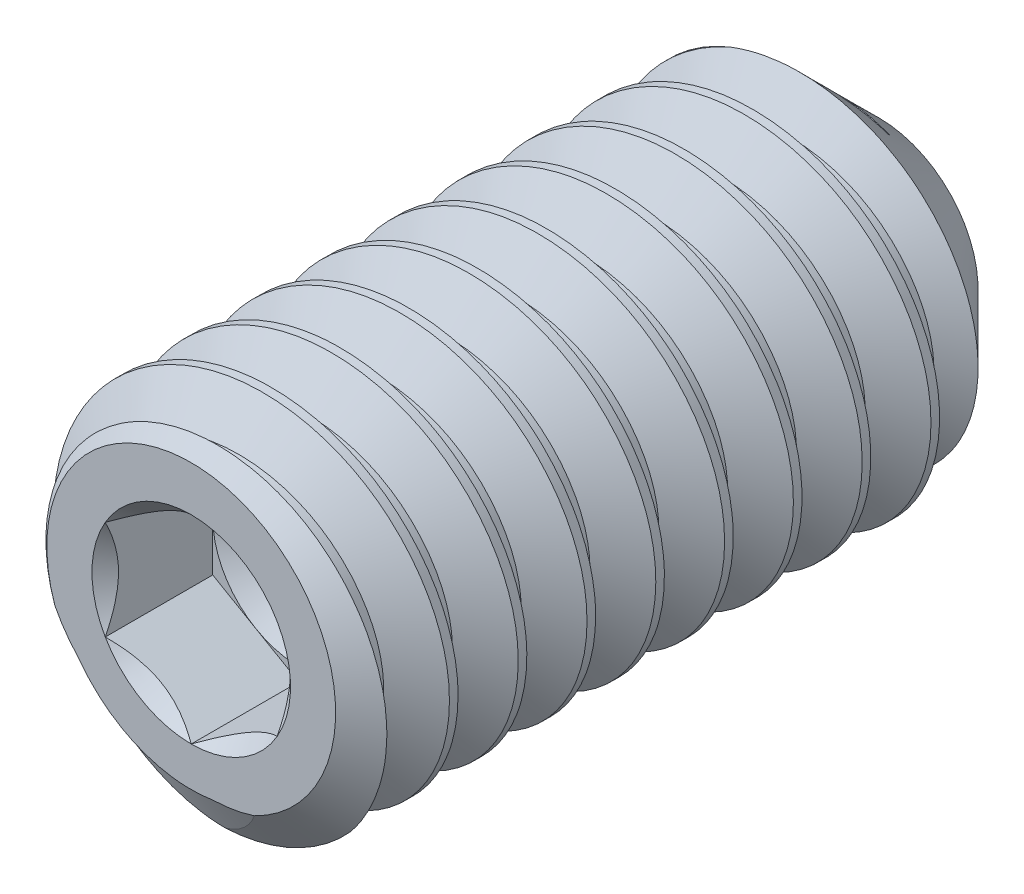
from build123d import *

# Parameters (mm, degrees)
CUT_SWEEP2_PITCH    = 0.79375
CUT_EXTRUDE10_DEPTH = 1.240234375


with BuildPart() as part:
    # Sketch22 → Revolve1 (revolve)
    with BuildSketch(Plane(origin=(0, 0, 0), x_dir=(0, 0, -1), z_dir=(1, 0, 0)), mode=Mode.PRIVATE) as revolve1_sk:
        Polygon((-3.625868495, 0), (-3.625868495, 1.66624), (-3.334190043, 2.0828), (3.370132812, 2.0828), (4.311631505, 1.141301307), (3.625868495, 0), align=None)
    revolve(revolve1_sk.sketch.rotate(Axis((0, 0, -3.625868495), (0, 0, -1)), 180), axis=Axis((0, 0, -3.625868495), (0, 0, -1)))

    # Cut-Sweep2: the profile of Sketch28 profile screwed along a right-hand helix of 11.32 turns, 8 arcs to a turn; built about Z, then put on its axis
    cut_sweep2_z = Axis((0, 0, 0), (0, 0, 1))
    cut_sweep2_corners = [(2.0831, 0, 0.000173205), (2.0831, 0, -0.694704455), (1.601614635, 0, -0.41671875), (1.601614635, 0, -0.2778125)]
    with BuildLine(mode=Mode.PRIVATE) as cut_sweep2_profile:
        Line(cut_sweep2_corners[0], cut_sweep2_corners[1])
        Line(cut_sweep2_corners[1], cut_sweep2_corners[2])
        Line(cut_sweep2_corners[2], cut_sweep2_corners[3])
        Line(cut_sweep2_corners[3], cut_sweep2_corners[0])
    cut_sweep2_cap = Face(cut_sweep2_profile.wire())
    cut_sweep2_turn_angles = [0, 22.5, 45, 67.5, 90, 112.5, 135, 157.5, 180, 202.5, 225, 247.5, 270, 292.5, 315, 337.5, 360]
    cut_sweep2_turn_weights = [1, 0.9238795325112867, 1, 0.9238795325112867, 1, 0.9238795325112867, 1, 0.9238795325112867, 1, 0.9238795325112867, 1, 0.9238795325112867, 1, 0.9238795325112867, 1, 0.9238795325112867, 1]
    cut_sweep2_turn_rails = [Edge.make_bspline([Vector(p[0], p[1], 0).rotate(cut_sweep2_z, cut_sweep2_turn_angles[k]) / cut_sweep2_turn_weights[k] + Vector(0, 0, p[2] + CUT_SWEEP2_PITCH * cut_sweep2_turn_angles[k] / 360) for k in range(17)], [0, 0, 0, 1, 1, 2, 2, 3, 3, 4, 4, 5, 5, 6, 6, 7, 7, 8, 8, 8], 2, cut_sweep2_turn_weights) for p in cut_sweep2_corners]
    cut_sweep2_turn_sides = [Face.make_surface_from_curves(cut_sweep2_turn_rails[p[0]], cut_sweep2_turn_rails[p[1]]) for p in [(0, 1), (1, 2), (2, 3), (3, 0)]]
    cut_sweep2_last_angles = [3960, 3982.5, 4005, 4027.5, 4050, 4062.6, 4075.2]
    cut_sweep2_last_weights = [1, 0.9238795325112867, 1, 0.9238795325112867, 1, 0.9759167619387122, 1]
    cut_sweep2_last_rails = [Edge.make_bspline([Vector(p[0], p[1], 0).rotate(cut_sweep2_z, cut_sweep2_last_angles[k]) / cut_sweep2_last_weights[k] + Vector(0, 0, p[2] + CUT_SWEEP2_PITCH * cut_sweep2_last_angles[k] / 360) for k in range(7)], [0, 0, 0, 1, 1, 2, 2, 3, 3, 3], 2, cut_sweep2_last_weights) for p in cut_sweep2_corners]
    cut_sweep2_last_sides = [Face.make_surface_from_curves(cut_sweep2_last_rails[p[0]], cut_sweep2_last_rails[p[1]]) for p in [(0, 1), (1, 2), (2, 3), (3, 0)]]
    cut_sweep2 = Plane(origin=(0, 0, -4.311631505), x_dir=(0, 1, 0), z_dir=(0, 0, 1)) * Solid(Shell([*[p.moved(Location((0, 0, CUT_SWEEP2_PITCH * i))) for i in range(11) for p in cut_sweep2_turn_sides], *cut_sweep2_last_sides, cut_sweep2_cap, cut_sweep2_cap.rotate(cut_sweep2_z, 4075.2).moved(Location((0, 0, CUT_SWEEP2_PITCH * 4075.2 / 360)))]))
    add(cut_sweep2, mode=Mode.SUBTRACT)

    # Sketch23 → Cut-Extrude10 (cut)
    with BuildSketch(Plane.XY.offset(3.625868495)):
        Polygon((0, 1.14567944), (-0.9921875, 0.57283972), (-0.9921875, -0.57283972), (0, -1.14567944), (0.9921875, -0.57283972), (0.9921875, 0.57283972), align=None)
    extrude(amount=-CUT_EXTRUDE10_DEPTH, mode=Mode.SUBTRACT)

    # Cut-Extrude11 cone 1 section (through the dimple's axis) → Cut-Extrude11 (revolve, cut)
    with BuildSketch(Plane(origin=(0, 0, 3.625868495), x_dir=(0, -1, 0), z_dir=(1, 0, 0))):
        Polygon((0, 0), (1.14567944, 0), (0, 1.14567944), align=None)
    revolve(axis=Axis((0, 0, 3.625868495), (0, 0, -1)), mode=Mode.SUBTRACT)

    # Cut-Extrude12 cone 1 section (through the dimple's axis) → Cut-Extrude12 (revolve, cut)
    with BuildSketch(Plane(origin=(0, 0, 2.38563412), x_dir=(0, -1, 0), z_dir=(1, 0, 0))):
        Polygon((0, 0), (0.9921875, 0), (0, 0.57283972), align=None)
    revolve(axis=Axis((0, 0, 2.38563412), (0, 0, -1)), mode=Mode.SUBTRACT)


solid = part.part
